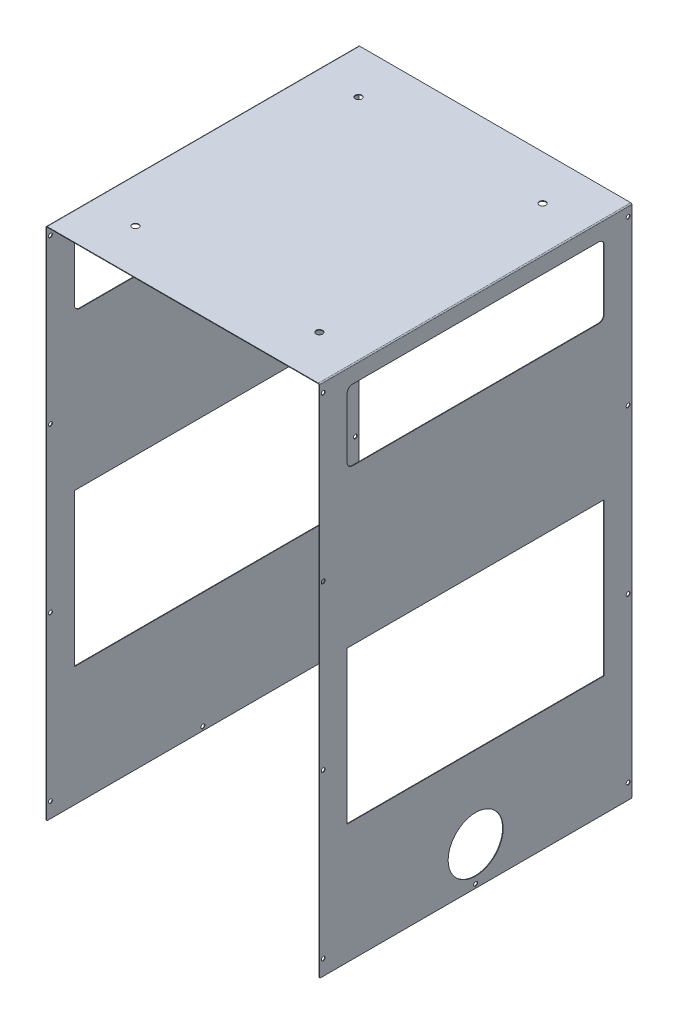
from build123d import *

# Parameters (mm, degrees)
SKETCH1_W                    = 500
SKETCH1_H                    = 574
BOSS_EXTRUDE1_DEPTH          = 2
CONVERT_SOLID1_OUTLINE_W     = 500
CONVERT_SOLID1_OUTLINE_H     = 574
CONVERT_SOLID1_DEPTH         = 1
EDGE_FLANGE1_STRIP_W         = 6
EDGE_FLANGE1_STRIP_H         = 1
EDGE_FLANGE1_STRIP_CUT_DEPTH = 574
EDGE_FLANGE1_DEPTH           = 574
SKETCH11_W                   = 280
SKETCH11_H                   = 472
CUT_EXTRUDE1_DEPTH           = 600
SKETCH12_R                   = 50.5
CUT_EXTRUDE2_DEPTH           = 10
SKETCH13_R                   = 6
CUT_EXTRUDE3_DEPTH           = 12
FILLET2_R                    = 2
CUT_EXTRUDE7_START           = -499
CUT_EXTRUDE7_OUTLINE_R       = 3.55
CUT_EXTRUDE7_DEPTH           = 502


# Read off the part's stored shape, not the designer's step: Convert-Solid1, Cut-Extrude7
# Sheet-metal steps are written as plain solids
with BuildPart() as part:
    # Sketch1 → Boss-Extrude1 (new body)
    with BuildSketch(Plane(origin=(0, 0, 0), x_dir=(1, 0, 0), z_dir=(0, 1, 0))):
        Rectangle(SKETCH1_W, SKETCH1_H)
    extrude(amount=BOSS_EXTRUDE1_DEPTH)

    # Convert-Solid1 outline → Convert-Solid1 (cut)
    with BuildSketch(Plane(origin=(0, 0, 0), x_dir=(1, 0, 0), z_dir=(0, 1, 0))):
        Rectangle(CONVERT_SOLID1_OUTLINE_W, CONVERT_SOLID1_OUTLINE_H)
    extrude(amount=CONVERT_SOLID1_DEPTH, mode=Mode.SUBTRACT)

    # Edge-Flange1 strip (across the edge) → Edge-Flange1 strip cut (cut)
    with BuildSketch(Plane(origin=(-250, 1, 287), x_dir=(1, 0, 0), z_dir=(0, 0, -1))):
        with Locations((-2, -0.5)):
            Rectangle(EDGE_FLANGE1_STRIP_W, EDGE_FLANGE1_STRIP_H)
    edge_flange1_strip_cut = extrude(amount=EDGE_FLANGE1_STRIP_CUT_DEPTH, mode=Mode.SUBTRACT)

    # Edge-Flange1 section (across the edge) → Edge-Flange1 (add)
    with BuildSketch(Plane(origin=(-250, 1, 287), x_dir=(1, 0, 0), z_dir=(0, 0, -1))):
        with BuildLine():
            Line((-1, 1), (-1, 945))
            Line((-1, 945), (0, 945))
            Line((0, 945), (0, 1))
            ThreePointArc((0, 1), (0.292893219, 0.292893219), (1, 0))
            Line((1, 0), (1, -1))
            ThreePointArc((1, -1), (-0.414213562, -0.414213562), (-1, 1))
        make_face()
    edge_flange1 = extrude(amount=EDGE_FLANGE1_DEPTH)

    # Mirror1: Edge-Flange1 strip cut, Edge-Flange1 across plane
    add(edge_flange1_strip_cut.mirror(Plane(origin=(0, 0, 0), x_dir=(0, 0, 1), z_dir=(1, 0, 0))), mode=Mode.SUBTRACT)
    add(edge_flange1.mirror(Plane(origin=(0, 0, 0), x_dir=(0, 0, 1), z_dir=(1, 0, 0))))

    # Sketch11 → Cut-Extrude1 (cut)
    with BuildSketch(Plane(origin=(251, 40.165636604, 898.471308301), x_dir=(0, 1, 0), z_dir=(1, 0, 0))):
        with Locations((-624.165636604, -898.471308301)):
            Rectangle(SKETCH11_W, SKETCH11_H)
        with BuildLine():
            Line((-189.165636604, -662.471308301), (-79.165636604, -662.471308301))
            ThreePointArc((-79.165636604, -662.471308301), (-72.094568792, -665.400240489), (-69.165636604, -672.471308301))
            Line((-69.165636604, -672.471308301), (-69.165636604, -1124.471308301))
            ThreePointArc((-69.165636604, -1124.471308301), (-72.094568792, -1131.542376113), (-79.165636604, -1134.471308301))
            Line((-79.165636604, -1134.471308301), (-189.165636604, -1134.471308301))
            ThreePointArc((-189.165636604, -1134.471308301), (-196.236704416, -1131.542376113), (-199.165636604, -1124.471308301))
            Line((-199.165636604, -1124.471308301), (-199.165636604, -672.471308301))
            ThreePointArc((-199.165636604, -672.471308301), (-196.236704416, -665.400240489), (-189.165636604, -662.471308301))
        make_face()
    extrude(amount=-CUT_EXTRUDE1_DEPTH, mode=Mode.SUBTRACT)

    # Sketch12 → Cut-Extrude2 (cut)
    with BuildSketch(Plane(origin=(251, 40.165636604, 898.471308301), x_dir=(0, 1, 0), z_dir=(1, 0, 0))):
        with Locations((-914.165636604, -898.471308301)):
            Circle(SKETCH12_R)
    extrude(amount=-CUT_EXTRUDE2_DEPTH, mode=Mode.SUBTRACT)

    # Sketch13 → Cut-Extrude3 (cut)
    with BuildSketch(Plane(origin=(-635.072358446, 2, 898.471308301), x_dir=(-1, 0, 0), z_dir=(0, 1, 0))):
        with Locations(Location((-804.072358446, -693.471308301, 0), (0, 0, 90))):
            Circle(SKETCH13_R)
        with Locations(Location((-466.072358446, -693.471308301, 0), (0, 0, 270))):
            Circle(SKETCH13_R)
        with Locations(Location((-466.072358446, -1103.471308301, 0), (0, 0, 90))):
            Circle(SKETCH13_R)
        with Locations(Location((-804.072358446, -1103.471308301, 0), (0, 0, 270))):
            Circle(SKETCH13_R)
    extrude(amount=-CUT_EXTRUDE3_DEPTH, mode=Mode.SUBTRACT)

    # Fillet2
    fillet2_edges = [part.edges().sort_by_distance(p)[0] for p in [
        (-250.5, -944, 287),
        (-250.5, -944, -287),
        (250.5, -944, -287),
        (250.5, -944, 287),
    ]]
    fillet(fillet2_edges, radius=FILLET2_R)

    # Cut-Extrude7 outline → Cut-Extrude7 (cut)
    with BuildSketch(Plane(origin=(-248, 561.16698045, 1244.210853702), x_dir=(0, -1, 0), z_dir=(-1, 0, 0)).offset(CUT_EXTRUDE7_START)):
        with Locations((577.16698045, -1524.210853702)):
            Circle(CUT_EXTRUDE7_OUTLINE_R)
        with Locations((877.16698045, -1524.210853702)):
            Circle(CUT_EXTRUDE7_OUTLINE_R)
        with Locations((1177.16698045, -1524.210853702)):
            Circle(CUT_EXTRUDE7_OUTLINE_R)
        with Locations((1477.16698045, -1524.210853702)):
            Circle(CUT_EXTRUDE7_OUTLINE_R)
        with Locations((1498.16698045, -1244.210853702)):
            Circle(CUT_EXTRUDE7_OUTLINE_R)
        with Locations((1477.16698045, -964.210853702)):
            Circle(CUT_EXTRUDE7_OUTLINE_R)
        with Locations((1177.16698045, -964.210853702)):
            Circle(CUT_EXTRUDE7_OUTLINE_R)
        with Locations((877.16698045, -964.210853702)):
            Circle(CUT_EXTRUDE7_OUTLINE_R)
        with Locations((577.16698045, -964.210853702)):
            Circle(CUT_EXTRUDE7_OUTLINE_R)
    extrude(amount=CUT_EXTRUDE7_DEPTH, mode=Mode.SUBTRACT)


solid = part.part
